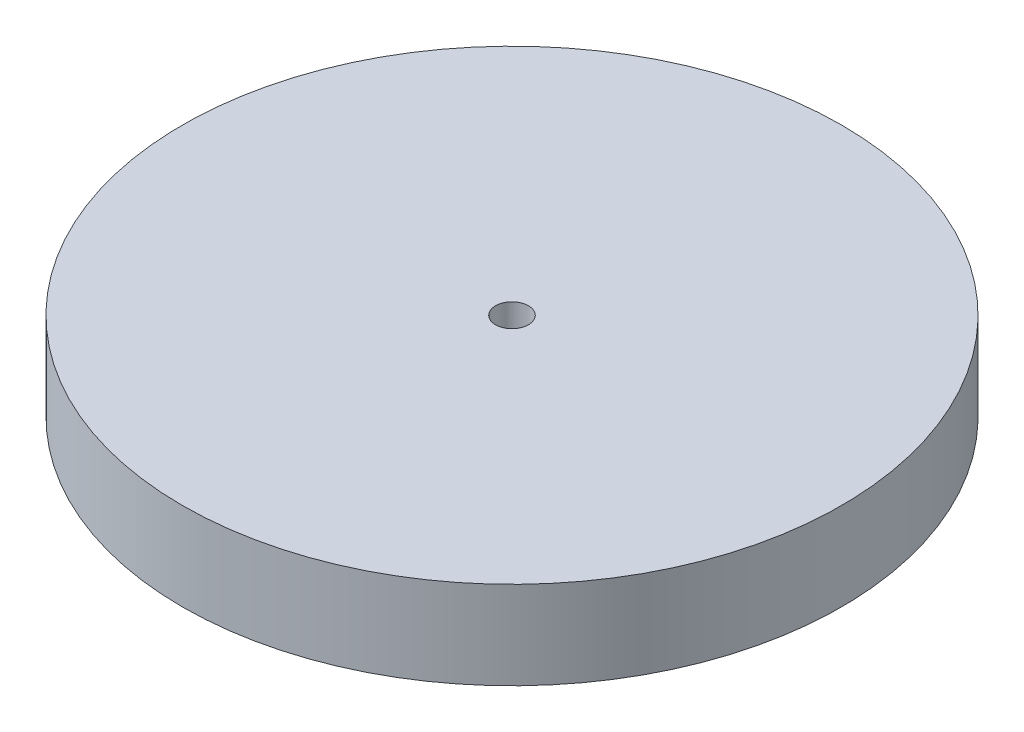
from build123d import *

# Parameters (mm, degrees)
SKETCH1_R           = 30
SKETCH1_R_2         = 1.5
BOSS_EXTRUDE1_DEPTH = 8


with BuildPart() as part:
    # Sketch1 → Boss-Extrude1 (new body)
    with BuildSketch(Plane(origin=(0, 0, 0), x_dir=(1, 0, 0), z_dir=(0, 1, 0))):
        Circle(SKETCH1_R)
        Circle(SKETCH1_R_2, mode=Mode.SUBTRACT)
    extrude(amount=BOSS_EXTRUDE1_DEPTH)


solid = part.part
